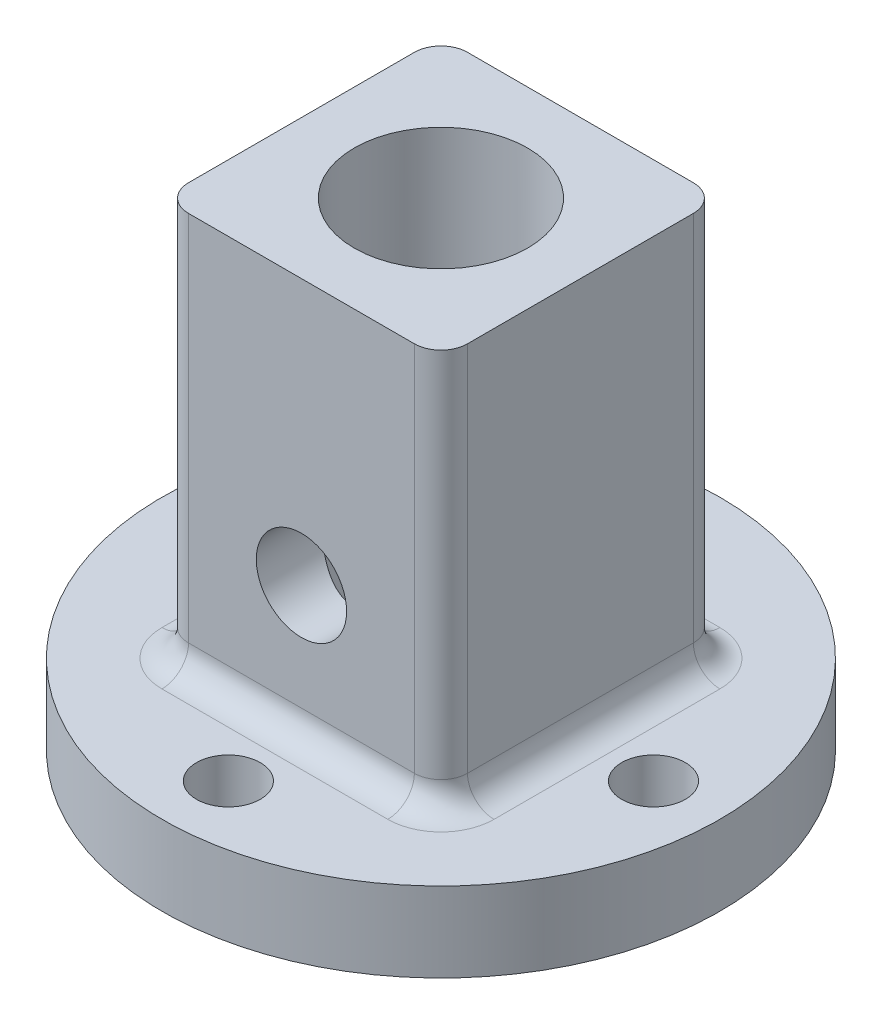
from build123d import *

# Parameters (mm, degrees)
SKETCH1_W           = 7.2361
SKETCH1_H           = 3
BOSS_EXTRUDE1_START = 15
SKETCH7_W           = 10.5
SKETCH7_H           = 10.5
SKETCH7_R           = 3.2639
BOSS_EXTRUDE1_DEPTH = 15
SKETCH3_R           = 1.7
CUT_EXTRUDE1_DEPTH  = 33.886404519
SKETCH4_R           = 1.2
CUT_EXTRUDE2_DEPTH  = 22.10687099
FILLET1_R           = 1
FILLET2_R           = 1
SKETCH8_R           = 4.25
CUT_EXTRUDE3_DEPTH  = 3
FILLET3_R           = 1


with BuildPart() as part:
    # Sketch1 → Revolve1 (revolve)
    with BuildSketch(Plane.XY, mode=Mode.PRIVATE) as revolve1_sk:
        with Locations((6.88195, 1.5)):
            Rectangle(SKETCH1_W, SKETCH1_H)
    revolve(revolve1_sk.sketch.rotate(Axis((0, 0, 0), (0, 1, 0)), 90), axis=Axis((0, 0, 0), (0, 1, 0)))

    # Sketch7 → Boss-Extrude1 (add)
    with BuildSketch(Plane(origin=(0, 3, 0), x_dir=(1, 0, 0), z_dir=(0, 1, 0)).offset(BOSS_EXTRUDE1_START)):
        Rectangle(SKETCH7_W, SKETCH7_H)
        with Locations(Location((0, 0, 0), (0, 0, 90))):
            Circle(SKETCH7_R, mode=Mode.SUBTRACT)
    extrude(amount=-BOSS_EXTRUDE1_DEPTH)

    # Sketch3 → Cut-Extrude1 (cut, through all)
    with BuildSketch(Plane(origin=(12.071067812, 0, 5.25), x_dir=(-1, 0, 0), z_dir=(0, 0, -1))):
        with Locations(Location((12.071067812, 8, 0), (0, 0, 180))):
            Circle(SKETCH3_R)
    extrude(amount=CUT_EXTRUDE1_DEPTH, mode=Mode.SUBTRACT)

    # Sketch4 → Cut-Extrude2 (cut, through all)
    with BuildSketch(Plane(origin=(0, 3, 0), x_dir=(1, 0, 0), z_dir=(0, 1, 0))):
        with Locations(Location((0, 8, 0), (0, 0, 270))):
            Circle(SKETCH4_R)
        with Locations(Location((8, 0, 0), (0, 0, 270))):
            Circle(SKETCH4_R)
        with Locations(Location((0, -8, 0), (0, 0, 270))):
            Circle(SKETCH4_R)
        with Locations(Location((-8, 0, 0), (0, 0, 270))):
            Circle(SKETCH4_R)
    extrude(amount=-CUT_EXTRUDE2_DEPTH, mode=Mode.SUBTRACT)

    # Fillet1
    fillet1_edges = [part.edges().sort_by_distance(p)[0] for p in [
        (5.25, 10.5, 5.25),
        (5.25, 10.5, -5.25),
        (-5.25, 10.5, -5.25),
        (-5.25, 10.5, 5.25),
    ]]
    fillet(fillet1_edges, radius=FILLET1_R)

    # Fillet2
    fillet2_edges = [part.edges().sort_by_distance(p)[0] for p in [
        (0, 3, -5.25),
        (5.25, 3, 0),
        (-5.25, 3, 0),
        (0, 3, 5.25),
        (4.957106781, 3, -4.957106781),
        (-4.957106781, 3, -4.957106781),
        (4.957106781, 3, 4.957106781),
        (-4.957106781, 3, 4.957106781),
    ]]
    fillet(fillet2_edges, radius=FILLET2_R)

    # Sketch8 → Cut-Extrude3 (cut)
    with BuildSketch(Plane.XZ):
        with Locations(Location((0, 0, 0), (0, 0, 270))):
            Circle(SKETCH8_R)
    extrude(amount=-CUT_EXTRUDE3_DEPTH, mode=Mode.SUBTRACT)

    # Fillet3
    # the kernel refuses this fillet: 1 mm, written as the material it adds along each edge
    with BuildSketch(Plane(origin=(0, 3, 0), x_dir=(0, 0, -1), z_dir=(-1, 0, 0))) as fillet3_piece_1_section:
        with BuildLine():
            CenterArc((4.25 - FILLET3_R, FILLET3_R), FILLET3_R, 270, 90)
            Line((4.25 - FILLET3_R, 0), (4.25, 0))
            Line((4.25, 0), (4.25, FILLET3_R))
        make_face()
    fillet3_piece_1 = revolve(axis=Axis((0, 3, 0), (0, -1, 0)), mode=Mode.PRIVATE)
    fillet3_piece_1 = fillet3_piece_1 - Plane(origin=(0, 2.715239817, 0), x_dir=(0, 0, -1), z_dir=(0, 1, 0)) * Cylinder(3.2639, 17, mode=Mode.PRIVATE)
    add(fillet3_piece_1)


solid = part.part
